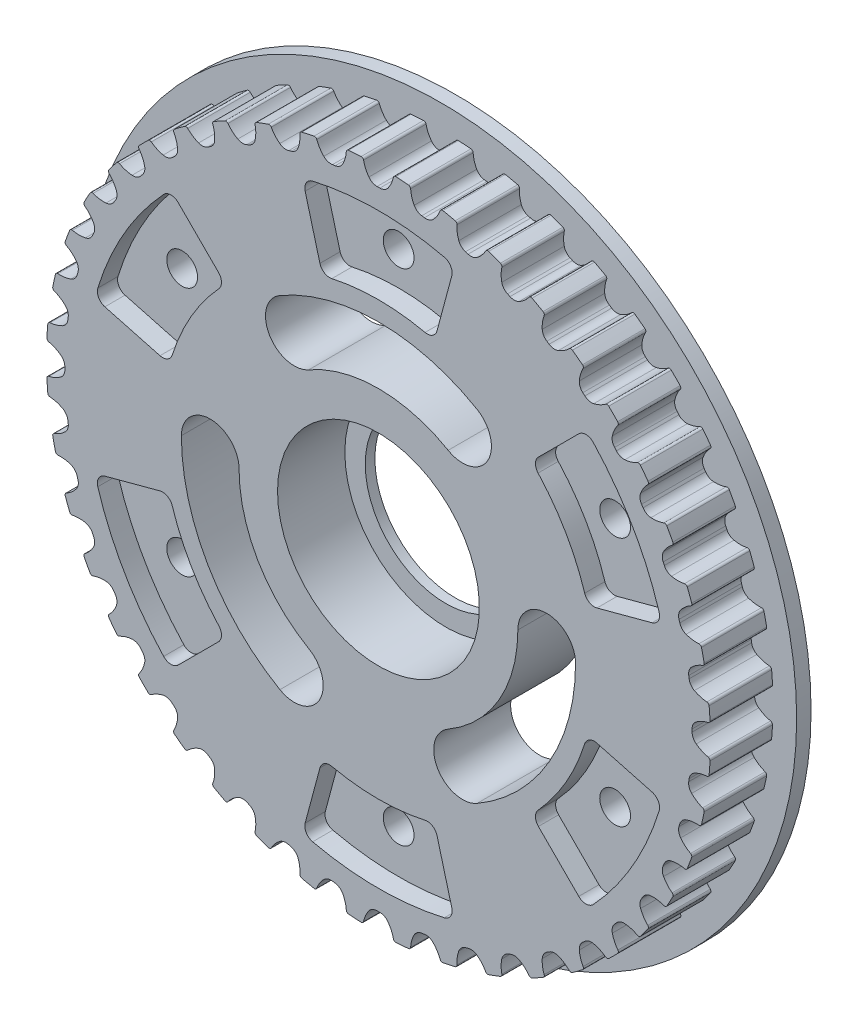
from build123d import *

# Parameters (mm, degrees)
SKETCH_1_R                       = 37
SKETCH_1_R_2                     = 10.5
EXTRUDE_1_DEPTH                  = 1.5
EXTRUDE_START                    = 1.5
EXTRUDE_2_OUTLINE_R              = 34.53408748
EXTRUDE_2_OUTLINE_R_2            = 10.5
EXTRUDE_2_DEPTH                  = 4.5
SKETCH_1_23_R                    = 34.53408748
SKETCH_1_23_R_2                  = 10.5
EXTRUDE_7_DEPTH                  = 8
CUT_EXTRUDE_START                = 1.5
CUT_EXTRUDE_1_DEPTH              = 6.5
FILLET_1_R                       = 0.25
FILLET_2_R                       = 1.05
PATTERN_CIRCULAR_1_COUNT         = 44
FILLET_1_OF_PATTERN_CIRCULAR_1_R = 0.25
FILLET_2_OF_PATTERN_CIRCULAR_1_R = 1.05
CUT_EXTRUDE_2_DEPTH              = 53.933921226
SKETCH_1_22_R                    = 10.5
SKETCH_1_22_R_2                  = 8.375
EXTRUDE_5_DEPTH                  = 1
EXTRUDE_9_DEPTH                  = 8
M3X0_5_1_D                       = 2.5
PATTERN_CIRCULAR_2_COUNT         = 6
CUT_EXTRUDE_START_2              = 8
CUT_EXTRUDE_3_DEPTH              = 2.1
HOLE_WIZARD_M3_1_D               = 3.2
HOLE_WIZARD_M3_1_CSINK_D         = 6.3
HOLE_WIZARD_M3_1_CSINK_ANGLE     = 90
PATTERN_CIRCULAR_3_COUNT         = 6


# Read off the part's stored shape, not the designer's step: ﾎﾞｽ - 押し出し2
with BuildPart() as part:
    # ｽｹｯﾁ1 → ﾎﾞｽ - 押し出し1 (new body)
    with BuildSketch(Plane.XY):
        Circle(SKETCH_1_R)
        Circle(SKETCH_1_R_2, mode=Mode.SUBTRACT)
    extrude(amount=EXTRUDE_1_DEPTH)

    # ﾎﾞｽ - 押し出し2 outline → ﾎﾞｽ - 押し出し2 (add)
    with BuildSketch(Plane.XY.offset(EXTRUDE_START)):
        Circle(EXTRUDE_2_OUTLINE_R)
        Circle(EXTRUDE_2_OUTLINE_R_2, mode=Mode.SUBTRACT)
    extrude(amount=EXTRUDE_2_DEPTH)

    # ｽｹｯﾁ1<23> → ﾎﾞｽ - 押し出し7 (add)
    with BuildSketch(Plane.XY):
        Circle(SKETCH_1_23_R)
        Circle(SKETCH_1_23_R_2, mode=Mode.SUBTRACT)
    extrude(amount=EXTRUDE_7_DEPTH)

    # ｽｹｯﾁ5 → ｶｯﾄ - 押し出し1 (cut)
    with BuildSketch(Plane.XY.offset(CUT_EXTRUDE_START)):
        with BuildLine():
            ThreePointArc((0.611585346, 32.618354454), (0, 32.62408748), (-0.611585346, 32.618354454))
            ThreePointArc((-0.611585346, 32.618354454), (-1.257956837, 33.476005866), (-1.589526623, 34.497486911))
            ThreePointArc((-1.589526623, 34.497486911), (0, 34.53408748), (1.589526623, 34.497486911))
            ThreePointArc((1.589526623, 34.497486911), (1.257956837, 33.476005866), (0.611585346, 32.618354454))
        make_face()
    cut_extrude_1 = extrude(amount=CUT_EXTRUDE_1_DEPTH, mode=Mode.SUBTRACT)

    # ﾌｨﾚｯﾄ1
    fillet_1_edges = [part.edges().sort_by_distance(p)[0] for p in [
        (-1.589526623, 34.497486911, 4.75),
        (1.589526623, 34.497486911, 4.75),
    ]]
    fillet(fillet_1_edges, radius=FILLET_1_R)

    # ﾌｨﾚｯﾄ2
    fillet_2_edges = [part.edges().sort_by_distance(p)[0] for p in [
        (-0.611585346, 32.618354454, 4.75),
        (0.611585346, 32.618354454, 4.75),
    ]]
    fillet(fillet_2_edges, radius=FILLET_2_R)

    # 円形ﾊﾟﾀｰﾝ1: ｶｯﾄ - 押し出し1 ×44 about axis
    pattern_circular_1_axis = Axis((0, 0, 0), (0, 0, 1))
    for i in range(1, PATTERN_CIRCULAR_1_COUNT):
        add(cut_extrude_1.rotate(pattern_circular_1_axis, i * 360 / PATTERN_CIRCULAR_1_COUNT), mode=Mode.SUBTRACT)

    # ﾌｨﾚｯﾄ1 of 円形ﾊﾟﾀｰﾝ1
    fillet_1_of_pattern_circular_1_edges = [part.edges().sort_by_distance(p)[0] for p in [
        (-6.482851805, 33.920139012, 4.75),
        (-3.336156737, 34.37256546, 4.75),
        (-11.244204818, 32.652274899, 4.75),
        (-8.193925566, 33.547917699, 4.75),
        (-15.776658248, 30.719704631, 4.75),
        (-12.8848897, 32.040331077, 4.75),
        (-19.987944411, 28.161769765, 4.75),
        (-17.313554637, 29.880495711, 4.75),
        (-23.792333667, 25.030542479, 4.75),
        (-21.389765529, 27.112379621, 4.75),
        (-27.112379621, 21.389765529, 4.75),
        (-25.030542479, 23.792333667, 4.75),
        (-29.880495711, 17.313554637, 4.75),
        (-28.161769765, 19.987944411, 4.75),
        (-32.040331077, 12.8848897, 4.75),
        (-30.719704631, 15.776658248, 4.75),
        (-33.547917699, 8.193925566, 4.75),
        (-32.652274899, 11.244204818, 4.75),
        (-34.37256546, 3.336156737, 4.75),
        (-33.920139012, 6.482851805, 4.75),
        (-34.497486911, -1.589526623, 4.75),
        (-34.497486911, 1.589526623, 4.75),
        (-33.920139012, -6.482851805, 4.75),
        (-34.37256546, -3.336156737, 4.75),
        (-32.652274899, -11.244204818, 4.75),
        (-33.547917699, -8.193925566, 4.75),
        (-30.719704631, -15.776658248, 4.75),
        (-32.040331077, -12.8848897, 4.75),
        (-28.161769765, -19.987944411, 4.75),
        (-29.880495711, -17.313554637, 4.75),
        (-25.030542479, -23.792333667, 4.75),
        (-27.112379621, -21.389765529, 4.75),
        (-21.389765529, -27.112379621, 4.75),
        (-23.792333667, -25.030542479, 4.75),
        (-17.313554637, -29.880495711, 4.75),
        (-19.987944411, -28.161769765, 4.75),
        (-12.8848897, -32.040331077, 4.75),
        (-15.776658248, -30.719704631, 4.75),
        (-8.193925566, -33.547917699, 4.75),
        (-11.244204818, -32.652274899, 4.75),
        (-3.336156737, -34.37256546, 4.75),
        (-6.482851805, -33.920139012, 4.75),
        (1.589526623, -34.497486911, 4.75),
        (-1.589526623, -34.497486911, 4.75),
        (6.482851805, -33.920139012, 4.75),
        (3.336156737, -34.37256546, 4.75),
        (11.244204818, -32.652274899, 4.75),
        (8.193925566, -33.547917699, 4.75),
        (15.776658248, -30.719704631, 4.75),
        (12.8848897, -32.040331077, 4.75),
        (19.987944411, -28.161769765, 4.75),
        (17.313554637, -29.880495711, 4.75),
        (23.792333667, -25.030542479, 4.75),
        (21.389765529, -27.112379621, 4.75),
        (27.112379621, -21.389765529, 4.75),
        (25.030542479, -23.792333667, 4.75),
        (29.880495711, -17.313554637, 4.75),
        (28.161769765, -19.987944411, 4.75),
        (32.040331077, -12.8848897, 4.75),
        (30.719704631, -15.776658248, 4.75),
        (33.547917699, -8.193925566, 4.75),
        (32.652274899, -11.244204818, 4.75),
        (34.37256546, -3.336156737, 4.75),
        (33.920139012, -6.482851805, 4.75),
        (34.497486911, 1.589526623, 4.75),
        (34.497486911, -1.589526623, 4.75),
        (33.920139012, 6.482851805, 4.75),
        (34.37256546, 3.336156737, 4.75),
        (32.652274899, 11.244204818, 4.75),
        (33.547917699, 8.193925566, 4.75),
        (30.719704631, 15.776658248, 4.75),
        (32.040331077, 12.8848897, 4.75),
        (28.161769765, 19.987944411, 4.75),
        (29.880495711, 17.313554637, 4.75),
        (25.030542479, 23.792333667, 4.75),
        (27.112379621, 21.389765529, 4.75),
        (21.389765529, 27.112379621, 4.75),
        (23.792333667, 25.030542479, 4.75),
        (17.313554637, 29.880495711, 4.75),
        (19.987944411, 28.161769765, 4.75),
        (12.8848897, 32.040331077, 4.75),
        (15.776658248, 30.719704631, 4.75),
        (8.193925566, 33.547917699, 4.75),
        (11.244204818, 32.652274899, 4.75),
        (3.336156737, 34.37256546, 4.75),
        (6.482851805, 33.920139012, 4.75),
    ]]
    fillet(fillet_1_of_pattern_circular_1_edges, radius=FILLET_1_OF_PATTERN_CIRCULAR_1_R)

    # ﾌｨﾚｯﾄ2 of 円形ﾊﾟﾀｰﾝ1
    fillet_2_of_pattern_circular_1_edges = [part.edges().sort_by_distance(p)[0] for p in [
        (-5.247436128, 32.199308968, 4.75),
        (-4.03671555, 32.373384307, 4.75),
        (-9.776464242, 31.124778406, 4.75),
        (-8.602840558, 31.469385413, 4.75),
        (-14.106471738, 29.416637113, 4.75),
        (-12.993836541, 29.924760582, 4.75),
        (-18.149312149, 27.109657918, 4.75),
        (-17.120315483, 27.770953921, 4.75),
        (-21.822684903, 24.250804266, 4.75),
        (-20.898274173, 25.051810723, 4.75),
        (-25.051810723, 20.898274173, 4.75),
        (-24.250804266, 21.822684903, 4.75),
        (-27.770953921, 17.120315483, 4.75),
        (-27.109657918, 18.149312149, 4.75),
        (-29.924760582, 12.993836541, 4.75),
        (-29.416637113, 14.106471738, 4.75),
        (-31.469385413, 8.602840558, 4.75),
        (-31.124778406, 9.776464242, 4.75),
        (-32.373384307, 4.03671555, 4.75),
        (-32.199308968, 5.247436128, 4.75),
        (-32.618354454, -0.611585346, 4.75),
        (-32.618354454, 0.611585346, 4.75),
        (-32.199308968, -5.247436128, 4.75),
        (-32.373384307, -4.03671555, 4.75),
        (-31.124778406, -9.776464242, 4.75),
        (-31.469385413, -8.602840558, 4.75),
        (-29.416637113, -14.106471738, 4.75),
        (-29.924760582, -12.993836541, 4.75),
        (-27.109657918, -18.149312149, 4.75),
        (-27.770953921, -17.120315483, 4.75),
        (-24.250804266, -21.822684903, 4.75),
        (-25.051810723, -20.898274173, 4.75),
        (-20.898274173, -25.051810723, 4.75),
        (-21.822684903, -24.250804266, 4.75),
        (-17.120315483, -27.770953921, 4.75),
        (-18.149312149, -27.109657918, 4.75),
        (-12.993836541, -29.924760582, 4.75),
        (-14.106471738, -29.416637113, 4.75),
        (-8.602840558, -31.469385413, 4.75),
        (-9.776464242, -31.124778406, 4.75),
        (-4.03671555, -32.373384307, 4.75),
        (-5.247436128, -32.199308968, 4.75),
        (0.611585346, -32.618354454, 4.75),
        (-0.611585346, -32.618354454, 4.75),
        (5.247436128, -32.199308968, 4.75),
        (4.03671555, -32.373384307, 4.75),
        (9.776464242, -31.124778406, 4.75),
        (8.602840558, -31.469385413, 4.75),
        (14.106471738, -29.416637113, 4.75),
        (12.993836541, -29.924760582, 4.75),
        (18.149312149, -27.109657918, 4.75),
        (17.120315483, -27.770953921, 4.75),
        (21.822684903, -24.250804266, 4.75),
        (20.898274173, -25.051810723, 4.75),
        (25.051810723, -20.898274173, 4.75),
        (24.250804266, -21.822684903, 4.75),
        (27.770953921, -17.120315483, 4.75),
        (27.109657918, -18.149312149, 4.75),
        (29.924760582, -12.993836541, 4.75),
        (29.416637113, -14.106471738, 4.75),
        (31.469385413, -8.602840558, 4.75),
        (31.124778406, -9.776464242, 4.75),
        (32.373384307, -4.03671555, 4.75),
        (32.199308968, -5.247436128, 4.75),
        (32.618354454, 0.611585346, 4.75),
        (32.618354454, -0.611585346, 4.75),
        (32.199308968, 5.247436128, 4.75),
        (32.373384307, 4.03671555, 4.75),
        (31.124778406, 9.776464242, 4.75),
        (31.469385413, 8.602840558, 4.75),
        (29.416637113, 14.106471738, 4.75),
        (29.924760582, 12.993836541, 4.75),
        (27.109657918, 18.149312149, 4.75),
        (27.770953921, 17.120315483, 4.75),
        (24.250804266, 21.822684903, 4.75),
        (25.051810723, 20.898274173, 4.75),
        (20.898274173, 25.051810723, 4.75),
        (21.822684903, 24.250804266, 4.75),
        (17.120315483, 27.770953921, 4.75),
        (18.149312149, 27.109657918, 4.75),
        (12.993836541, 29.924760582, 4.75),
        (14.106471738, 29.416637113, 4.75),
        (8.602840558, 31.469385413, 4.75),
        (9.776464242, 31.124778406, 4.75),
        (4.03671555, 32.373384307, 4.75),
        (5.247436128, 32.199308968, 4.75),
    ]]
    fillet(fillet_2_of_pattern_circular_1_edges, radius=FILLET_2_OF_PATTERN_CIRCULAR_1_R)

    # ｽｹｯﾁ1<21> → ｶｯﾄ - 押し出し2 (cut, through all)
    with BuildSketch(Plane.XY):
        with BuildLine():
            ThreePointArc((10.25, 17.753520778), (0, 20.5), (-10.25, 17.753520778))
            ThreePointArc((-10.25, 17.753520778), (-11.348076211, 13.655444566), (-7.25, 12.557368355))
            ThreePointArc((-7.25, 12.557368355), (0, 14.5), (7.25, 12.557368355))
            ThreePointArc((7.25, 12.557368355), (11.348076211, 13.655444566), (10.25, 17.753520778))
        make_face()
        with BuildLine():
            ThreePointArc((10.25, -17.753520778), (17.753520778, -10.25), (20.5, 0))
            ThreePointArc((20.5, 0), (17.5, 3), (14.5, 0))
            ThreePointArc((14.5, 0), (12.557368355, -7.25), (7.25, -12.557368355))
            ThreePointArc((7.25, -12.557368355), (6.151923789, -16.655444566), (10.25, -17.753520778))
        make_face()
        with BuildLine():
            ThreePointArc((-20.5, 0), (-17.753520778, -10.25), (-10.25, -17.753520778))
            ThreePointArc((-10.25, -17.753520778), (-6.151923789, -16.655444566), (-7.25, -12.557368355))
            ThreePointArc((-7.25, -12.557368355), (-12.557368355, -7.25), (-14.5, 0))
            ThreePointArc((-14.5, 0), (-17.5, 3), (-20.5, 0))
        make_face()
    extrude(amount=CUT_EXTRUDE_2_DEPTH, mode=Mode.SUBTRACT)

    # ｽｹｯﾁ1<22> → ﾎﾞｽ - 押し出し5 (add)
    with BuildSketch(Plane.XY):
        Circle(SKETCH_1_22_R)
        Circle(SKETCH_1_22_R_2, mode=Mode.SUBTRACT)
    extrude(amount=EXTRUDE_5_DEPTH)

    # ｽｹｯﾁ1<24> → ﾎﾞｽ - 押し出し9 (add)
    with BuildSketch(Plane.XY):
        with BuildLine():
            ThreePointArc((6.847449397, 29.756393179), (0, 30.53408748), (-6.847449397, 29.756393179))
            ThreePointArc((-6.847449397, 29.756393179), (-7.511813413, 29.274247345), (-7.626202815, 28.461376375))
            Line((-7.626202815, 28.461376375), (-6.089127154, 22.724931914))
            ThreePointArc((-6.089127154, 22.724931914), (-5.620051154, 22.099298068), (-4.848635385, 21.971361699))
            ThreePointArc((-4.848635385, 21.971361699), (0, 22.5), (4.848635385, 21.971361699))
            ThreePointArc((4.848635385, 21.971361699), (5.620051154, 22.099298068), (6.089127154, 22.724931914))
            Line((6.089127154, 22.724931914), (7.626202815, 28.461376375))
            ThreePointArc((7.626202815, 28.461376375), (7.511813413, 29.274247345), (6.847449397, 29.756393179))
        make_face()
    extrude_9 = extrude(amount=EXTRUDE_9_DEPTH)

    # M3x0.5 ねじ穴1 (through all)
    with Locations(Plane(origin=(0, 26, 0), x_dir=(-1, 0, 0), z_dir=(0, 0, -1))):
        with Locations((0, 0), (22.516660498, -13), (22.516660498, -39), (0, -52), (-22.516660498, -39), (-22.516660498, -13)):
            m3x0_5_1 = Hole(M3X0_5_1_D / 2)

    # 円形ﾊﾟﾀｰﾝ2: ﾎﾞｽ - 押し出し9, M3x0.5 ねじ穴1 ×6 about axis, 1 skipped
    pattern_circular_2_axis = Axis((0, 0, 1.5), (0, 0, -1))
    add([extrude_9.rotate(pattern_circular_2_axis, i * 360 / PATTERN_CIRCULAR_2_COUNT) for i in range(1, PATTERN_CIRCULAR_2_COUNT) if i not in (1,)])
    add([m3x0_5_1.rotate(pattern_circular_2_axis, i * 360 / PATTERN_CIRCULAR_2_COUNT) for i in range(1, PATTERN_CIRCULAR_2_COUNT) if i not in (1,)], mode=Mode.SUBTRACT)

    # ｽｹｯﾁ1<25> → ｶｯﾄ - 押し出し3 (cut)
    with BuildSketch(Plane.XY.offset(CUT_EXTRUDE_START_2)):
        with BuildLine():
            Line((-6.089127154, 22.724931914), (-7.626202815, 28.461376375))
            ThreePointArc((-7.626202815, 28.461376375), (-7.511813413, 29.274247345), (-6.847449397, 29.756393179))
            ThreePointArc((-6.847449397, 29.756393179), (0, 30.53408748), (6.847449397, 29.756393179))
            ThreePointArc((6.847449397, 29.756393179), (7.511813413, 29.274247345), (7.626202815, 28.461376375))
            Line((7.626202815, 28.461376375), (6.089127154, 22.724931914))
            ThreePointArc((6.089127154, 22.724931914), (5.620051154, 22.099298068), (4.848635385, 21.971361699))
            ThreePointArc((4.848635385, 21.971361699), (0, 22.5), (-4.848635385, 21.971361699))
            ThreePointArc((-4.848635385, 21.971361699), (-5.620051154, 22.099298068), (-6.089127154, 22.724931914))
        make_face()
    cut_extrude_3 = extrude(amount=-CUT_EXTRUDE_3_DEPTH, mode=Mode.SUBTRACT)

    # M3 丸皿ねじ用皿穴1 (through all)
    with Locations(Plane(origin=(0, 26, 0), x_dir=(-1, 0, 0), z_dir=(0, 0, -1))):
        with Locations((0, 0)):
            hole_wizard_m3_1 = CounterSinkHole(HOLE_WIZARD_M3_1_D / 2, HOLE_WIZARD_M3_1_CSINK_D / 2, counter_sink_angle=HOLE_WIZARD_M3_1_CSINK_ANGLE)

    # 円形ﾊﾟﾀｰﾝ3: ｶｯﾄ - 押し出し3, M3 丸皿ねじ用皿穴1 ×6 about axis
    pattern_circular_3_axis = Axis((0, 0, 0), (0, 0, 1))
    add([cut_extrude_3.rotate(pattern_circular_3_axis, i * 360 / PATTERN_CIRCULAR_3_COUNT) for i in range(1, PATTERN_CIRCULAR_3_COUNT)], mode=Mode.SUBTRACT)
    add([hole_wizard_m3_1.rotate(pattern_circular_3_axis, i * 360 / PATTERN_CIRCULAR_3_COUNT) for i in range(1, PATTERN_CIRCULAR_3_COUNT)], mode=Mode.SUBTRACT)


solid = part.part
